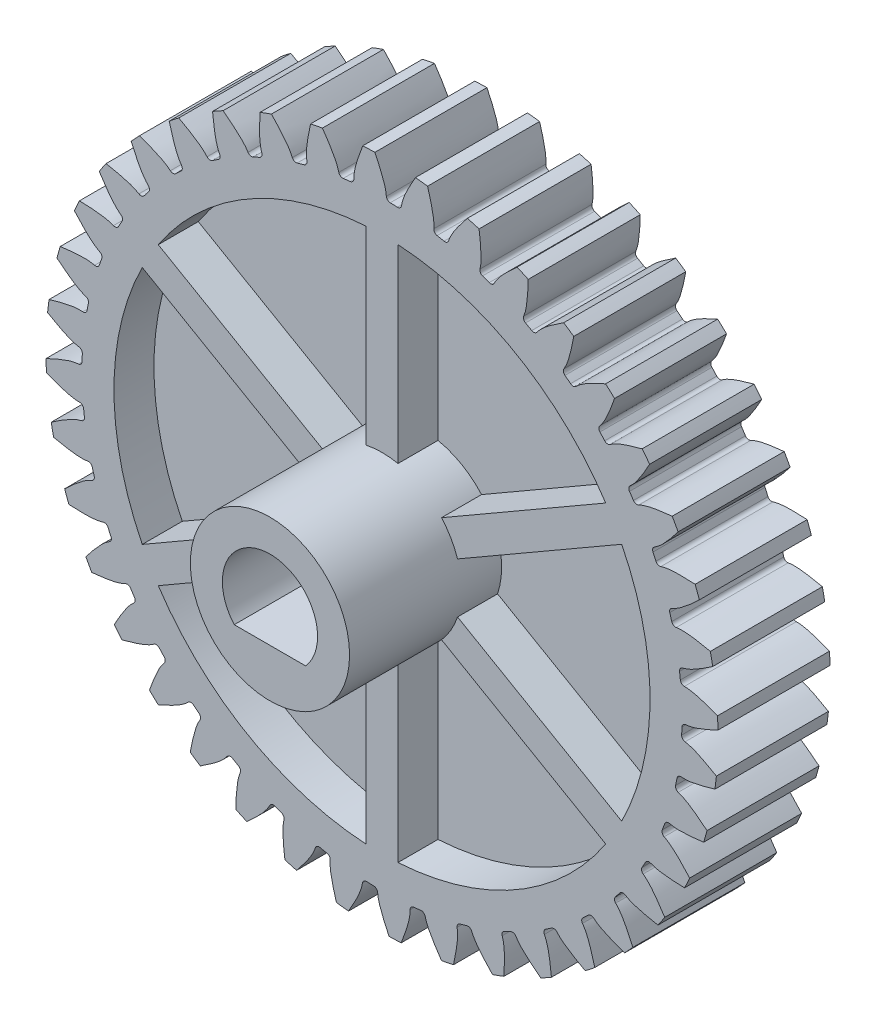
from build123d import *
from build123d.topology import SkipClean

# Parameters (mm, degrees)
ESQUISSE1_R                        = 18.75
BASE_EXTRUSION_DEPTH               = 3.5
ESQUISSE9_R                        = 16.75
ENL_V_MAT_EXTRU_4_DEPTH            = 2.5
BOSS_EXTRU_1_DEPTH                 = 3.5
CONG_1_R                           = 0.25
R_P_TITION_CIRCULAIRE1_COUNT       = 40
CONG_1_OF_R_P_TITION_CIRCULAIRE1_R = 0.25
ENL_V_MAT_EXTRU_2_DEPTH            = 30.897448
ENL_V_MAT_EXTRU_2_DEPTH_BACK       = 30.897448
ESQUISSE3_R                        = 2.975
BOSS_EXTRU_2_START                 = -3.5
ESQUISSE5_R                        = 4.975
BOSS_EXTRU_2_DEPTH                 = 14
NERVURE1_REACH                     = 32.506
ESQUISSE8_WALLS_W                  = 2
ESQUISSE8_WALLS_H                  = 74.786716


with BuildPart() as part:
    # Esquisse1 → Base-Extrusion (new, symmetric)
    with BuildSketch(Plane.XY):
        Circle(ESQUISSE1_R)
    extrude(amount=BASE_EXTRUSION_DEPTH, both=True)

    # Esquisse9 → Enlèv. mat.-Extru.4 (cut)
    with BuildSketch(Plane.XY.offset(3.5)):
        Circle(ESQUISSE9_R)
    enl_v_mat_extru_4 = extrude(amount=-ENL_V_MAT_EXTRU_4_DEPTH, mode=Mode.SUBTRACT)

    # Symétrie1: Enlèv. mat.-Extru.4 across plane
    add(enl_v_mat_extru_4.mirror(Plane.XY), mode=Mode.SUBTRACT)

    # Esquisse2 → Boss.-Extru.1 (add, symmetric)
    with BuildSketch(Plane.XY):
        with BuildLine():
            Line((17.070349, 1.068086), (17.101566, 0.272139))
            add(Edge.make_bspline(
                [(17.101566, 0.272139), (17.263355, 0.191453), (17.793502, -0.072938), (18.791627, -0.415576), (19.970267, -0.039521), (20.668706, 0.289298), (20.995325, 0.443067)],
                knots=[0, 0, 0, 0, 0.132388, 0.433806, 0.735224, 1, 1, 1, 1], degree=3))
            ThreePointArc((20.995325, 0.443067), (20.983867, 0.822989), (20.965535, 1.202642))
            add(Edge.make_bspline(
                [(17.070349, 1.068086), (17.225322, 1.161196), (17.733133, 1.466295), (18.701357, 1.886055), (19.905829, 1.603465), (20.627876, 1.330358), (20.965535, 1.202642)],
                knots=[0, 0, 0, 0, 0.132388, 0.433806, 0.735224, 1, 1, 1, 1], degree=3))
        make_face()
    boss_extru_1 = extrude(amount=BOSS_EXTRU_1_DEPTH, both=True)

    # Congé1
    cong_1_edges = [part.edges().sort_by_distance(p)[0] for p in [
        (18.747924, -0.278978, 1.75),
        (18.668487, 1.746453, -1.75),
    ]]
    fillet(cong_1_edges, radius=CONG_1_R)

    # Répétition circulaire1: Boss.-Extru.1 ×40 about axis
    r_p_tition_circulaire1_axis = Axis((0, 0, -50), (0, 0, 1))
    for i in range(1, R_P_TITION_CIRCULAIRE1_COUNT):
        add(boss_extru_1.rotate(r_p_tition_circulaire1_axis, i * 360 / R_P_TITION_CIRCULAIRE1_COUNT))

    # Congé1 of Répétition circulaire1
    cong_1_of_r_p_tition_circulaire1_edges = [part.edges().sort_by_distance(p)[0] for p in [
        (18.560748, 2.657278, 1.75),
        (18.165441, 4.645346, -1.75),
        (17.916545, 5.528103, 1.75),
        (17.215102, 7.429856, -1.75),
        (16.831177, 8.262808, 1.75),
        (15.84087, 10.031417, -1.75),
        (15.331369, 10.794055, 1.75),
        (14.076584, 12.385972, -1.75),
        (13.454052, 13.059517, 1.75),
        (11.965685, 14.435543, -1.75),
        (11.245452, 15.00341, 1.75),
        (9.560151, 16.129663, -1.75),
        (8.759951, 16.577869, 1.75),
        (6.919214, 17.426617, -1.75),
        (6.058751, 17.744127, 1.75),
        (4.107904, 18.29447, -1.75),
        (3.208365, 18.473465, 1.75),
        (1.195443, 18.711852, -1.75),
        (0.278978, 18.747924, 1.75),
        (-1.746453, 18.668487, -1.75),
        (-2.657278, 18.560748, 1.75),
        (-4.645346, 18.165441, -1.75),
        (-5.528103, 17.916545, 1.75),
        (-7.429856, 17.215102, -1.75),
        (-8.262808, 16.831177, 1.75),
        (-10.031417, 15.84087, -1.75),
        (-10.794055, 15.331369, 1.75),
        (-12.385972, 14.076584, -1.75),
        (-13.059517, 13.454052, 1.75),
        (-14.435543, 11.965685, -1.75),
        (-15.00341, 11.245452, 1.75),
        (-16.129663, 9.560151, -1.75),
        (-16.577869, 8.759951, 1.75),
        (-17.426617, 6.919214, -1.75),
        (-17.744127, 6.058751, 1.75),
        (-18.29447, 4.107904, -1.75),
        (-18.473465, 3.208365, 1.75),
        (-18.711852, 1.195443, -1.75),
        (-18.747924, 0.278978, 1.75),
        (-18.668487, -1.746453, -1.75),
        (-18.560748, -2.657278, 1.75),
        (-18.165441, -4.645346, -1.75),
        (-17.916545, -5.528103, 1.75),
        (-17.215102, -7.429856, -1.75),
        (-16.831177, -8.262808, 1.75),
        (-15.84087, -10.031417, -1.75),
        (-15.331369, -10.794055, 1.75),
        (-14.076584, -12.385972, -1.75),
        (-13.454052, -13.059517, 1.75),
        (-11.965685, -14.435543, -1.75),
        (-11.245452, -15.00341, 1.75),
        (-9.560151, -16.129663, -1.75),
        (-8.759951, -16.577869, 1.75),
        (-6.919214, -17.426617, -1.75),
        (-6.058751, -17.744127, 1.75),
        (-4.107904, -18.29447, -1.75),
        (-3.208365, -18.473465, 1.75),
        (-1.195443, -18.711852, -1.75),
        (-0.278978, -18.747924, 1.75),
        (1.746453, -18.668487, -1.75),
        (2.657278, -18.560748, 1.75),
        (4.645346, -18.165441, -1.75),
        (5.528103, -17.916545, 1.75),
        (7.429856, -17.215102, -1.75),
        (8.262808, -16.831177, 1.75),
        (10.031417, -15.84087, -1.75),
        (10.794055, -15.331369, 1.75),
        (12.385972, -14.076584, -1.75),
        (13.059517, -13.454052, 1.75),
        (14.435543, -11.965685, -1.75),
        (15.00341, -11.245452, 1.75),
        (16.129663, -9.560151, -1.75),
        (16.577869, -8.759951, 1.75),
        (17.426617, -6.919214, -1.75),
        (17.744127, -6.058751, 1.75),
        (18.29447, -4.107904, -1.75),
        (18.473465, -3.208365, 1.75),
        (18.711852, -1.195443, -1.75),
    ]]
    fillet(cong_1_of_r_p_tition_circulaire1_edges, radius=CONG_1_OF_R_P_TITION_CIRCULAIRE1_R)

    # Esquisse3 → Enlèv. mat.-Extru.2 (cut, two sides: drawn at the far end of the back side and taken through both)
    with BuildSketch(Plane.XY.offset(-ENL_V_MAT_EXTRU_2_DEPTH_BACK)):
        Circle(ESQUISSE3_R)
    extrude(amount=ENL_V_MAT_EXTRU_2_DEPTH + ENL_V_MAT_EXTRU_2_DEPTH_BACK, mode=Mode.SUBTRACT)

    # Esquisse5 → Boss.-Extru.2 (add)
    with SkipClean():  # the faces are left unmerged after this step: merging them gives an invalid solid
        with BuildSketch(Plane.XY.offset(BOSS_EXTRU_2_START)):
            Circle(ESQUISSE5_R)
            with BuildLine():
                Line((2.233696, -1.965), (-2.233696, -1.965))
                ThreePointArc((-2.233696, -1.965), (0, 2.975), (2.233696, -1.965))
            make_face(mode=Mode.SUBTRACT)
        extrude(amount=BOSS_EXTRU_2_DEPTH)

    # Esquisse8 walls → Nervure1 (add, up to next)
    with BuildSketch(Plane.XY.offset(3.5), mode=Mode.PRIVATE) as nervure1_sk1:
        Polygon((23.476397, -12.399404), (-41.290799, 24.993955), (-42.290799, 23.261904), (22.476397, -14.131455), align=None)
    nervure1_tool1 = extrude(nervure1_sk1.sketch, amount=-NERVURE1_REACH, mode=Mode.PRIVATE) - part.part
    # Esquisse8 walls → Nervure1 (add, up to next)
    with BuildSketch(Plane.XY.offset(3.5), mode=Mode.PRIVATE) as nervure1_sk2:
        with Locations((0, 10.8625)):
            Rectangle(ESQUISSE8_WALLS_W, ESQUISSE8_WALLS_H)
    nervure1_tool2 = extrude(nervure1_sk2.sketch, amount=-NERVURE1_REACH, mode=Mode.PRIVATE) - part.part
    # Esquisse8 walls → Nervure1 (add, up to next)
    with BuildSketch(Plane.XY.offset(3.5), mode=Mode.PRIVATE) as nervure1_sk3:
        Polygon((-22.476397, -14.131455), (42.290799, 23.261904), (41.290799, 24.993955), (-23.476397, -12.399404), align=None)
    nervure1_tool3 = extrude(nervure1_sk3.sketch, amount=-NERVURE1_REACH, mode=Mode.PRIVATE) - part.part
    # Esquisse8 walls → Nervure1 (add, up to next)
    with BuildSketch(Plane.XY.offset(3.5), mode=Mode.PRIVATE) as nervure1_sk4:
        Polygon((-23.476397, 12.399404), (41.290799, -24.993955), (42.290799, -23.261904), (-22.476397, 14.131455), align=None)
    nervure1_tool4 = extrude(nervure1_sk4.sketch, amount=-NERVURE1_REACH, mode=Mode.PRIVATE) - part.part
    # Esquisse8 walls → Nervure1 (add, up to next)
    with BuildSketch(Plane.XY.offset(3.5), mode=Mode.PRIVATE) as nervure1_sk5:
        with Locations((0, -10.8625)):
            Rectangle(ESQUISSE8_WALLS_W, ESQUISSE8_WALLS_H)
    nervure1_tool5 = extrude(nervure1_sk5.sketch, amount=-NERVURE1_REACH, mode=Mode.PRIVATE) - part.part
    # Esquisse8 walls → Nervure1 (add, up to next)
    with BuildSketch(Plane.XY.offset(3.5), mode=Mode.PRIVATE) as nervure1_sk6:
        Polygon((22.476397, 14.131455), (-42.290799, -23.261904), (-41.290799, -24.993955), (23.476397, 12.399404), align=None)
    nervure1_tool6 = extrude(nervure1_sk6.sketch, amount=-NERVURE1_REACH, mode=Mode.PRIVATE) - part.part
    nervure1_1 = nervure1_tool1.solids().sort_by_distance((-9.407201, 5.43125, 3.5))[0]
    add(nervure1_1)
    nervure1_2 = nervure1_tool2.solids().sort_by_distance((0, 10.8625, 3.5))[0]
    add(nervure1_2)
    nervure1_3 = nervure1_tool3.solids().sort_by_distance((9.407201, 5.43125, 3.5))[0]
    add(nervure1_3)
    nervure1_4 = nervure1_tool4.solids().sort_by_distance((9.407201, -5.43125, 3.5))[0]
    add(nervure1_4)
    nervure1_5 = nervure1_tool5.solids().sort_by_distance((0, -10.8625, 3.5))[0]
    add(nervure1_5)
    nervure1_6 = nervure1_tool6.solids().sort_by_distance((-9.407201, -5.43125, 3.5))[0]
    add(nervure1_6)
    nervure1 = nervure1_1 + nervure1_2 + nervure1_3 + nervure1_4 + nervure1_5 + nervure1_6  # Nervure1 as one shape, for the pattern or mirror that repeats it

    # Symétrie3: Nervure1 across plane
    with SkipClean():  # the faces are left unmerged after this step: merging them gives an invalid solid
        add(nervure1.mirror(Plane.XY))


solid = part.part
